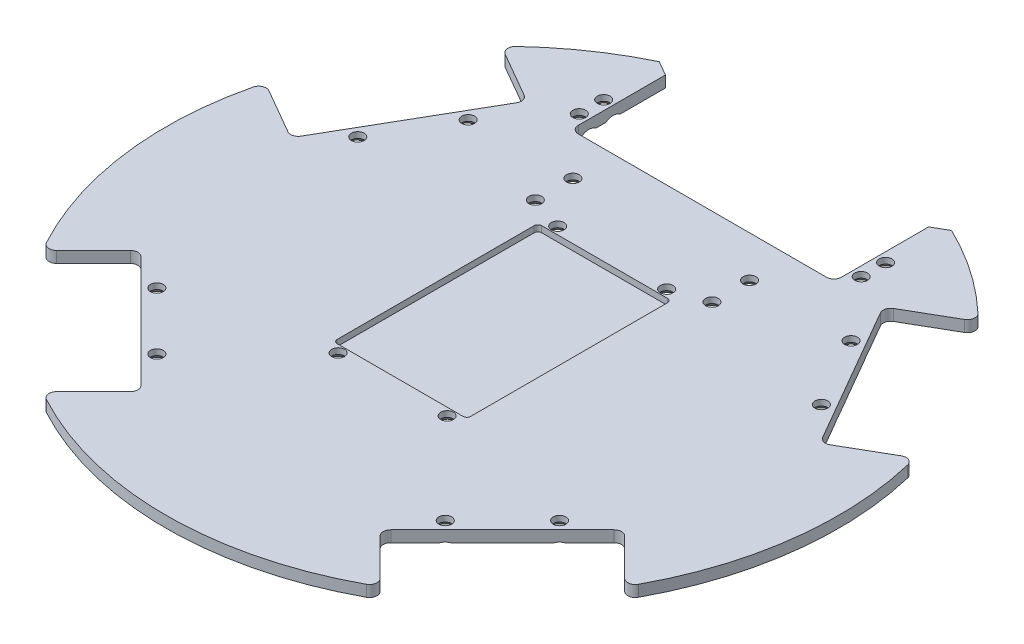
from build123d import *

# Parameters (mm, degrees)
SKETCH1_R                                     = 90
BOSS_EXTRUDE1_DEPTH                           = 3
CUT_EXTRUDE2_DEPTH                            = 128.314571044
CSK_FOR_M3_COUNTERSUNK_FLAT_HEAD_SCR_2_COUNT  = 2
CSK_FOR_M3_COUNTERSUNK_FLAT_HEAD_SCR_2_PITCH  = 21.5
CSK_FOR_M3_COUNTERSUNK_FLAT_HEAD_SCR_3_COUNT  = 2
CSK_FOR_M3_COUNTERSUNK_FLAT_HEAD_SCR_3_PITCH  = 80.213992028
CSK_FOR_M3_COUNTERSUNK_FLAT_HEAD_SCR_4_COUNT  = 2
CSK_FOR_M3_COUNTERSUNK_FLAT_HEAD_SCR_4_PITCH  = 96.196082587
CSK_FOR_M3_COUNTERSUNK_FLAT_HEAD_SCR_5_COUNT  = 2
CSK_FOR_M3_COUNTERSUNK_FLAT_HEAD_SCR_5_PITCH  = 130.63861542
CSK_FOR_M3_COUNTERSUNK_FLAT_HEAD_SCR_6_COUNT  = 2
CSK_FOR_M3_COUNTERSUNK_FLAT_HEAD_SCR_6_PITCH  = 131.694145111
CSK_FOR_M3_COUNTERSUNK_FLAT_HEAD_SCR_7_COUNT  = 2
CSK_FOR_M3_COUNTERSUNK_FLAT_HEAD_SCR_7_PITCH  = 114.112608856
CSK_FOR_M3_COUNTERSUNK_FLAT_HEAD_SCR_8_COUNT  = 2
CSK_FOR_M3_COUNTERSUNK_FLAT_HEAD_SCR_8_PITCH  = 101.833302492
CSK_FOR_M3_COUNTERSUNK_FLAT_HEAD_SCR_9_COUNT  = 2
CSK_FOR_M3_COUNTERSUNK_FLAT_HEAD_SCR_9_PITCH  = 58.4
CSK_FOR_M3_COUNTERSUNK_FLAT_HEAD_SCR_10_COUNT = 2
CSK_FOR_M3_COUNTERSUNK_FLAT_HEAD_SCR_10_PITCH = 62.50511979
CSK_FOR_M3_COUNTERSUNK_FLAT_HEAD_SCR_11_COUNT = 2
CSK_FOR_M3_COUNTERSUNK_FLAT_HEAD_SCR_11_PITCH = 29
CSK_FOR_M3_COUNTERSUNK_FLAT_HEAD_SCR_12_COUNT = 2
CSK_FOR_M3_COUNTERSUNK_FLAT_HEAD_SCR_12_PITCH = 65.203987608
CSK_FOR_M3_COUNTERSUNK_FLAT_HEAD_SCR_13_COUNT = 2
CSK_FOR_M3_COUNTERSUNK_FLAT_HEAD_SCR_13_PITCH = 59.41853667
CSK_FOR_M3_COUNTERSUNK_FLAT_HEAD_SCR_14_COUNT = 2
CSK_FOR_M3_COUNTERSUNK_FLAT_HEAD_SCR_14_PITCH = 62.821672216
CSK_FOR_M3_COUNTERSUNK_FLAT_HEAD_SCR_15_COUNT = 2
CSK_FOR_M3_COUNTERSUNK_FLAT_HEAD_SCR_15_PITCH = 42.089933476
CSK_FOR_M3_COUNTERSUNK_FLAT_HEAD_SCR_16_COUNT = 2
CSK_FOR_M3_COUNTERSUNK_FLAT_HEAD_SCR_16_PITCH = 36.817964365
CSK_FOR_M3_COUNTERSUNK_FLAT_HEAD_SCR_17_COUNT = 2
CSK_FOR_M3_COUNTERSUNK_FLAT_HEAD_SCR_17_PITCH = 40.178383492
CSK_FOR_M3_COUNTERSUNK_FLAT_HEAD_SCR_18_COUNT = 2
CSK_FOR_M3_COUNTERSUNK_FLAT_HEAD_SCR_18_PITCH = 38.122204816
CSK_FOR_M3_COUNTERSUNK_FLAT_HEAD_SCR_19_COUNT = 2
CSK_FOR_M3_COUNTERSUNK_FLAT_HEAD_SCR_19_PITCH = 15.852523458
CSK_FOR_M3_COUNTERSUNK_FLAT_HEAD_SCR_20_COUNT = 2
CSK_FOR_M3_COUNTERSUNK_FLAT_HEAD_SCR_20_PITCH = 9.502762756
CUT_EXTRUDE3_DEPTH                            = 1.65
CUT_EXTRUDE4_DEPTH                            = 128.314571044
CUT_EXTRUDE4_DEPTH_BACK                       = 128.314571044
SKETCH19_R                                    = 90
SKETCH19_R_2                                  = 89.5
FILLET2_R                                     = 2
CHAMFER1_SIZE                                 = 4
FILLET3_R                                     = 1


with BuildPart() as part:
    # Sketch1 → Boss-Extrude1 (new body)
    with BuildSketch(Plane(origin=(0, 0, 0), x_dir=(1, 0, 0), z_dir=(0, 1, 0))):
        with Locations(Location((0, 0, 0), (0, 0, 270))):
            Circle(SKETCH1_R)
    extrude(amount=BOSS_EXTRUDE1_DEPTH)

    # Sketch11 → Cut-Extrude2 (cut, through all)
    with BuildSketch(Plane(origin=(0, 3, 0), x_dir=(1, 0, 0), z_dir=(0, 1, 0))):
        with BuildLine():
            Line((-64.346717088, -31.819805153), (-31.819805153, -64.346717088))
            Line((-31.819805153, -64.346717088), (-45.262961123, -77.789873058))
            ThreePointArc((-45.262961123, -77.789873058), (-63.639610307, -63.639610307), (-77.789873058, -45.262961123))
            Line((-77.789873058, -45.262961123), (-64.346717088, -31.819805153))
        make_face()
        with BuildLine():
            Line((31.819805153, -64.346717088), (45.262961123, -77.789873058))
            ThreePointArc((45.262961123, -77.789873058), (63.639610307, -63.639610307), (77.789873058, -45.262961123))
            Line((77.789873058, -45.262961123), (64.346717088, -31.819805153))
            Line((64.346717088, -31.819805153), (31.819805153, -64.346717088))
        make_face()
        with BuildLine():
            Line((-47.389727457, 53.918584287), (-70.389727457, 14.081415713))
            Line((-70.389727457, 14.081415713), (-86.854163787, 23.58716246))
            ThreePointArc((-86.854163787, 23.58716246), (-77.942286341, 45), (-63.854163787, 63.424331034))
            Line((-63.854163787, 63.424331034), (-47.389727457, 53.918584287))
        make_face()
        with BuildLine():
            Line((47.389727457, 53.918584287), (63.854163787, 63.424331034))
            ThreePointArc((63.854163787, 63.424331034), (77.942286341, 45), (86.854163787, 23.58716246))
            Line((86.854163787, 23.58716246), (70.389727457, 14.081415713))
            Line((70.389727457, 14.081415713), (47.389727457, 53.918584287))
        make_face()
        with BuildLine():
            Line((35, 53.2), (-35, 53.2))
            Line((-35, 53.2), (-35, 82.915619759))
            ThreePointArc((-35, 82.915619759), (0, 90), (35, 82.915619759))
            Line((35, 82.915619759), (35, 53.2))
        make_face()
    extrude(amount=-CUT_EXTRUDE2_DEPTH, mode=Mode.SUBTRACT)

    # Sketch13 → CSK for M3 Countersunk Flat Head Screw1 (revolve, cut)
    with BuildSketch(Plane(origin=(-50.916651246, 0, -41.809773091), x_dir=(0, 0, -1), z_dir=(1, 0, 0))):
        Polygon((0, 0), (0, 3), (1.7, 3), (1.7, 1.45), (3.15, 0), align=None)
    csk_for_m3_countersunk_flat_head_screw1 = revolve(axis=Axis((-50.916651246, -6.35, -41.809773091), (0, 1, 0)), mode=Mode.SUBTRACT)

    # CSK for M3 Countersunk Flat Head Scr 2: CSK for M3 Countersunk Flat Head Screw1 ×2
    with Locations(*[Vector(-0.5000000000000001, 0, 0.8660254037844387) * (i * CSK_FOR_M3_COUNTERSUNK_FLAT_HEAD_SCR_2_PITCH) for i in range(1, CSK_FOR_M3_COUNTERSUNK_FLAT_HEAD_SCR_2_COUNT)]):
        add(csk_for_m3_countersunk_flat_head_screw1, mode=Mode.SUBTRACT)

    # CSK for M3 Countersunk Flat Head Scr 3: CSK for M3 Countersunk Flat Head Screw1 ×2
    with Locations(*[Vector(-0.032995333631624005, 0, 0.9994555057422706) * (i * CSK_FOR_M3_COUNTERSUNK_FLAT_HEAD_SCR_3_PITCH) for i in range(1, CSK_FOR_M3_COUNTERSUNK_FLAT_HEAD_SCR_3_COUNT)]):
        add(csk_for_m3_countersunk_flat_head_screw1, mode=Mode.SUBTRACT)

    # CSK for M3 Countersunk Flat Head Scr 4: CSK for M3 Countersunk Flat Head Screw1 ×2
    with Locations(*[Vector(0.13052619222006, 0, 0.9914448613738094) * (i * CSK_FOR_M3_COUNTERSUNK_FLAT_HEAD_SCR_4_PITCH) for i in range(1, CSK_FOR_M3_COUNTERSUNK_FLAT_HEAD_SCR_4_COUNT)]):
        add(csk_for_m3_countersunk_flat_head_screw1, mode=Mode.SUBTRACT)

    # CSK for M3 Countersunk Flat Head Scr 5: CSK for M3 Countersunk Flat Head Screw1 ×2
    with Locations(*[Vector(0.683390541446146, 0, 0.7300529897630333) * (i * CSK_FOR_M3_COUNTERSUNK_FLAT_HEAD_SCR_5_PITCH) for i in range(1, CSK_FOR_M3_COUNTERSUNK_FLAT_HEAD_SCR_5_COUNT)]):
        add(csk_for_m3_countersunk_flat_head_screw1, mode=Mode.SUBTRACT)

    # CSK for M3 Countersunk Flat Head Scr 6: CSK for M3 Countersunk Flat Head Screw1 ×2
    with Locations(*[Vector(0.7933533402912333, 0, 0.6087614290087232) * (i * CSK_FOR_M3_COUNTERSUNK_FLAT_HEAD_SCR_6_PITCH) for i in range(1, CSK_FOR_M3_COUNTERSUNK_FLAT_HEAD_SCR_6_COUNT)]):
        add(csk_for_m3_countersunk_flat_head_screw1, mode=Mode.SUBTRACT)

    # CSK for M3 Countersunk Flat Head Scr 7: CSK for M3 Countersunk Flat Head Screw1 ×2
    with Locations(*[Vector(0.9865982700799694, 0, 0.1631681754363024) * (i * CSK_FOR_M3_COUNTERSUNK_FLAT_HEAD_SCR_7_PITCH) for i in range(1, CSK_FOR_M3_COUNTERSUNK_FLAT_HEAD_SCR_7_COUNT)]):
        add(csk_for_m3_countersunk_flat_head_screw1, mode=Mode.SUBTRACT)

    # CSK for M3 Countersunk Flat Head Scr 8: CSK for M3 Countersunk Flat Head Screw1 ×2
    with Locations(*[(i * CSK_FOR_M3_COUNTERSUNK_FLAT_HEAD_SCR_8_PITCH, 0, 0) for i in range(1, CSK_FOR_M3_COUNTERSUNK_FLAT_HEAD_SCR_8_COUNT)]):
        add(csk_for_m3_countersunk_flat_head_screw1, mode=Mode.SUBTRACT)

    # Sketch16 → CSK for M3 Countersunk Flat Head Screw2 (revolve, cut)
    with BuildSketch(Plane(origin=(-14.5, 0, -29.2), x_dir=(0, 0, -1), z_dir=(1, 0, 0))):
        Polygon((0, 0), (0, 3), (1.7, 3), (1.7, 1.45), (3.15, 0), align=None)
    csk_for_m3_countersunk_flat_head_screw2 = revolve(axis=Axis((-14.5, -6.35, -29.2), (0, 1, 0)), mode=Mode.SUBTRACT)

    # CSK for M3 Countersunk Flat Head Scr 9: CSK for M3 Countersunk Flat Head Screw2 ×2
    with Locations(*[(0, 0, i * CSK_FOR_M3_COUNTERSUNK_FLAT_HEAD_SCR_9_PITCH) for i in range(1, CSK_FOR_M3_COUNTERSUNK_FLAT_HEAD_SCR_9_COUNT)]):
        add(csk_for_m3_countersunk_flat_head_screw2, mode=Mode.SUBTRACT)

    # CSK for M3 Countersunk Flat Head Scr 10: CSK for M3 Countersunk Flat Head Screw2 ×2
    with Locations(*[Vector(0.23198099689506987, 0, -0.9727203180151885) * (i * CSK_FOR_M3_COUNTERSUNK_FLAT_HEAD_SCR_10_PITCH) for i in range(1, CSK_FOR_M3_COUNTERSUNK_FLAT_HEAD_SCR_10_COUNT)]):
        add(csk_for_m3_countersunk_flat_head_screw2, mode=Mode.SUBTRACT)

    # CSK for M3 Countersunk Flat Head Scr 11: CSK for M3 Countersunk Flat Head Screw2 ×2
    with Locations(*[(i * CSK_FOR_M3_COUNTERSUNK_FLAT_HEAD_SCR_11_PITCH, 0, 0) for i in range(1, CSK_FOR_M3_COUNTERSUNK_FLAT_HEAD_SCR_11_COUNT)]):
        add(csk_for_m3_countersunk_flat_head_screw2, mode=Mode.SUBTRACT)

    # CSK for M3 Countersunk Flat Head Scr 12: CSK for M3 Countersunk Flat Head Screw2 ×2
    with Locations(*[Vector(0.4447580748326519, 0, 0.8956507438009267) * (i * CSK_FOR_M3_COUNTERSUNK_FLAT_HEAD_SCR_12_PITCH) for i in range(1, CSK_FOR_M3_COUNTERSUNK_FLAT_HEAD_SCR_12_COUNT)]):
        add(csk_for_m3_countersunk_flat_head_screw2, mode=Mode.SUBTRACT)

    # CSK for M3 Countersunk Flat Head Scr 13: CSK for M3 Countersunk Flat Head Screw2 ×2
    with Locations(*[Vector(0.8751477722992274, 0, -0.4838557394923612) * (i * CSK_FOR_M3_COUNTERSUNK_FLAT_HEAD_SCR_13_PITCH) for i in range(1, CSK_FOR_M3_COUNTERSUNK_FLAT_HEAD_SCR_13_COUNT)]):
        add(csk_for_m3_countersunk_flat_head_screw2, mode=Mode.SUBTRACT)

    # CSK for M3 Countersunk Flat Head Scr 14: CSK for M3 Countersunk Flat Head Screw2 ×2
    with Locations(*[Vector(0.8277398255382956, 0, -0.561112093273556) * (i * CSK_FOR_M3_COUNTERSUNK_FLAT_HEAD_SCR_14_PITCH) for i in range(1, CSK_FOR_M3_COUNTERSUNK_FLAT_HEAD_SCR_14_COUNT)]):
        add(csk_for_m3_countersunk_flat_head_screw2, mode=Mode.SUBTRACT)

    # CSK for M3 Countersunk Flat Head Scr 15: CSK for M3 Countersunk Flat Head Screw2 ×2
    with Locations(*[Vector(-0.5464489511062383, 0, -0.8374924141954315) * (i * CSK_FOR_M3_COUNTERSUNK_FLAT_HEAD_SCR_15_PITCH) for i in range(1, CSK_FOR_M3_COUNTERSUNK_FLAT_HEAD_SCR_15_COUNT)]):
        add(csk_for_m3_countersunk_flat_head_screw2, mode=Mode.SUBTRACT)

    # CSK for M3 Countersunk Flat Head Scr 16: CSK for M3 Countersunk Flat Head Screw2 ×2
    with Locations(*[Vector(-0.6246950475544241, 0, -0.7808688094430305) * (i * CSK_FOR_M3_COUNTERSUNK_FLAT_HEAD_SCR_16_PITCH) for i in range(1, CSK_FOR_M3_COUNTERSUNK_FLAT_HEAD_SCR_16_COUNT)]):
        add(csk_for_m3_countersunk_flat_head_screw2, mode=Mode.SUBTRACT)

    # CSK for M3 Countersunk Flat Head Scr 17: CSK for M3 Countersunk Flat Head Screw2 ×2
    with Locations(*[Vector(0.9457822017135636, 0, -0.3248015192726846) * (i * CSK_FOR_M3_COUNTERSUNK_FLAT_HEAD_SCR_17_PITCH) for i in range(1, CSK_FOR_M3_COUNTERSUNK_FLAT_HEAD_SCR_17_COUNT)]):
        add(csk_for_m3_countersunk_flat_head_screw2, mode=Mode.SUBTRACT)

    # CSK for M3 Countersunk Flat Head Scr 18: CSK for M3 Countersunk Flat Head Screw2 ×2
    with Locations(*[Vector(0.9967943927651168, 0, -0.0800058657350952) * (i * CSK_FOR_M3_COUNTERSUNK_FLAT_HEAD_SCR_18_PITCH) for i in range(1, CSK_FOR_M3_COUNTERSUNK_FLAT_HEAD_SCR_18_COUNT)]):
        add(csk_for_m3_countersunk_flat_head_screw2, mode=Mode.SUBTRACT)

    # CSK for M3 Countersunk Flat Head Scr 19: CSK for M3 Countersunk Flat Head Screw2 ×2
    with Locations(*[Vector(-0.5677329558036587, 0, -0.823212785915307) * (i * CSK_FOR_M3_COUNTERSUNK_FLAT_HEAD_SCR_19_PITCH) for i in range(1, CSK_FOR_M3_COUNTERSUNK_FLAT_HEAD_SCR_19_COUNT)]):
        add(csk_for_m3_countersunk_flat_head_screw2, mode=Mode.SUBTRACT)

    # CSK for M3 Countersunk Flat Head Scr 20: CSK for M3 Countersunk Flat Head Screw2 ×2
    with Locations(*[Vector(-0.9470929908419532, 0, -0.32095929134088647) * (i * CSK_FOR_M3_COUNTERSUNK_FLAT_HEAD_SCR_20_PITCH) for i in range(1, CSK_FOR_M3_COUNTERSUNK_FLAT_HEAD_SCR_20_COUNT)]):
        add(csk_for_m3_countersunk_flat_head_screw2, mode=Mode.SUBTRACT)

    # Sketch17 → Cut-Extrude3 (cut)
    with BuildSketch(Plane.XZ.offset(-3)):
        Polygon((-12, -27.2), (12, -27.2), (17.75, -27.2), (17.75, -24.7), (17.75, 24.7), (17.75, 27.2), (12, 27.2), (-12, 27.2), (-17.75, 27.2), (-17.75, 24.7), (-17.75, -24.7), (-17.75, -27.2), align=None)
    extrude(amount=CUT_EXTRUDE3_DEPTH, mode=Mode.SUBTRACT)

    # Sketch19 → Cut-Extrude4 (cut, two sides: drawn at the far end of the back side and taken through both)
    with BuildSketch(Plane.XZ.offset(-CUT_EXTRUDE4_DEPTH_BACK)):
        Circle(SKETCH19_R)
        Circle(SKETCH19_R_2, mode=Mode.SUBTRACT)
    extrude(amount=CUT_EXTRUDE4_DEPTH + CUT_EXTRUDE4_DEPTH_BACK, mode=Mode.SUBTRACT)

    # Fillet2
    fillet2_edges = [part.edges().sort_by_distance(p)[0] for p in [
        (63.406191333, 1.5, -63.165694017),
        (-44.897193146, 1.5, 77.424105081),
        (44.897193146, 1.5, 77.424105081),
        (77.424105081, 1.5, 44.897193146),
        (86.406191333, 1.5, -23.328525443),
        (-63.406191333, 1.5, -63.165694017),
        (-86.406191333, 1.5, -23.328525443),
        (-77.424105081, 1.5, 44.897193146),
        (70.389727457, 1.5, -14.081415713),
        (47.389727457, 1.5, -53.918584287),
        (-70.389727457, 1.5, -14.081415713),
        (-47.389727457, 1.5, -53.918584287),
        (31.819805153, 1.5, 64.346717088),
        (64.346717088, 1.5, 31.819805153),
        (35, 1.5, -53.2),
        (-35, 1.5, -53.2),
        (-31.819805153, 1.5, 64.346717088),
        (-64.346717088, 1.5, 31.819805153),
    ]]
    fillet(fillet2_edges, radius=FILLET2_R)

    # Chamfer1
    # the kernel refuses this chamfer: 4.336352737, 4 mm, written as the material it takes off along each edge
    with BuildSketch(Plane(origin=(35, 13.911163191, -82.372628949), x_dir=(0, 0, 1), z_dir=(0, -1, 0))) as chamfer1_piece_1:
        with BuildLine():
            Line((CHAMFER1_SIZE, 0), (1.759271109, -3.881056284))
            ThreePointArc((1.759271109, -3.881056284), (0.87738854, -1.996970021), (0, 0))
            Line((0, 0), (CHAMFER1_SIZE, 0))
        make_face()
    extrude(amount=24.822326381, mode=Mode.SUBTRACT)
    with BuildSketch(Plane(origin=(-35, 13.911163191, -82.372628949), x_dir=(-0.910794349168057, 0, 0.4128603317388769), z_dir=(0, -1, 0))) as chamfer1_piece_2:
        with BuildLine():
            Line((4.261177387, 0), (CHAMFER1_SIZE * 0.412860331739, -CHAMFER1_SIZE * 0.910794349168))
            Line((CHAMFER1_SIZE * 0.412860331739, -CHAMFER1_SIZE * 0.910794349168), (0, 0))
            ThreePointArc((0, 0), (2.181067934, 0.025349181), (4.261177387, 0))
        make_face()
    extrude(amount=24.822326381, mode=Mode.SUBTRACT)

    # Fillet3
    fillet3_edges = [part.edges().sort_by_distance(p)[0] for p in [
        (17.75, 2.175, 27.2),
        (-17.75, 2.175, 27.2),
        (-17.75, 2.175, -27.2),
        (17.75, 2.175, -27.2),
    ]]
    fillet(fillet3_edges, radius=FILLET3_R)


solid = part.part
